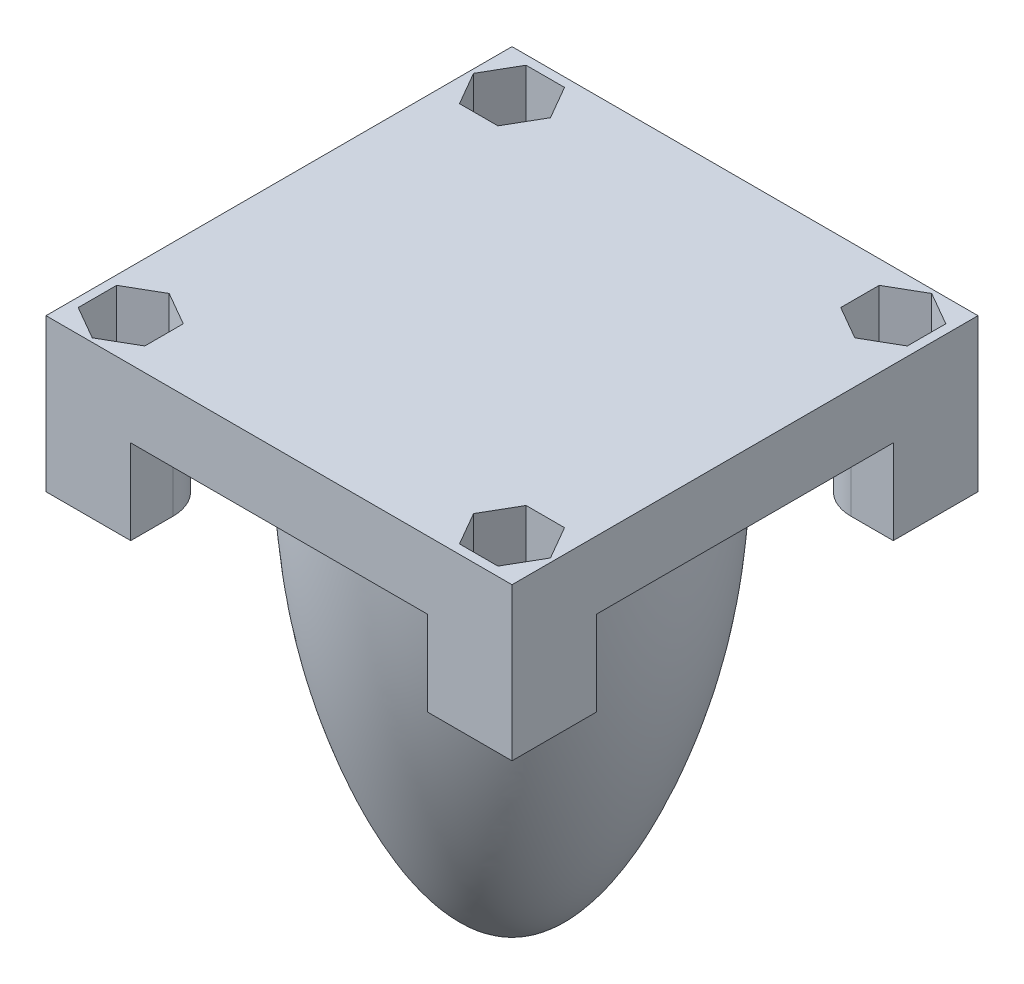
from build123d import *

# Parameters (mm, degrees)
SKETCH5_W           = 55
SKETCH5_H           = 70
BOSS_EXTRUDE8_DEPTH = 27.5
SKETCH6_W           = 10
SKETCH6_H           = 10
BOSS_EXTRUDE9_DEPTH = 10
SKETCH7_R           = 1.75
CUT_EXTRUDE2_DEPTH  = 59.723930461
CUT_EXTRUDE3_DEPTH  = 7
CIRPATTERN1_COUNT   = 4
FILLET1_R           = 5


with BuildPart() as part:
    # Sketch5 → Boss-Extrude8 (new, symmetric)
    with BuildSketch(Plane.XY):
        with Locations((0, 30)):
            Rectangle(SKETCH5_W, SKETCH5_H)
    extrude(amount=BOSS_EXTRUDE8_DEPTH, both=True)

    # Sketch1 → Cut-Revolve1 (revolve, cut)
    with BuildSketch(Plane(origin=(0, 0, 0), x_dir=(0, 0, -1), z_dir=(1, 0, 0))):
        with BuildLine():
            Line((0, -7), (0, 3))
            add(Edge.make_bspline(
                [(20, 55), (20, 43.957678864), (18.5157836, 25.942674232), (6.738040747, 3), (0, 3)],
                knots=[0, 0, 0, 0, 0.518417095, 1, 1, 1, 1], degree=3))
            Line((20, 55), (20, 57))
            ThreePointArc((20, 57), (20.585786438, 58.414213562), (22, 59))
            Line((22, 59), (23.4, 59))
            ThreePointArc((23.4, 59), (24.814213562, 58.414213562), (25.4, 57))
            Line((25.4, 57), (304.80691679, 57))
            Line((304.80691679, 57), (304.80691679, -311.267440696))
            Line((304.80691679, -311.267440696), (0, -311.267440696))
            Line((0, -311.267440696), (0, -7))
        make_face()
    revolve(axis=Axis((0, 0, 0), (0, 1, 0)), mode=Mode.SUBTRACT)

    # Sketch6 → Boss-Extrude9 (add)
    with BuildSketch(Plane.XZ.offset(-57)):
        with Locations((-22.5, 22.5)):
            Rectangle(SKETCH6_W, SKETCH6_H)
    boss_extrude9 = extrude(amount=BOSS_EXTRUDE9_DEPTH)

    # Sketch7 → Cut-Extrude2 (cut, through all)
    with BuildSketch(Plane.XZ.offset(-47)):
        with Locations(Location((-22.5, 22.5, 0), (0, 0, 270))):
            Circle(SKETCH7_R)
    cut_extrude2 = extrude(amount=-CUT_EXTRUDE2_DEPTH, mode=Mode.SUBTRACT)

    # Sketch8 → Cut-Extrude3 (cut)
    with BuildSketch(Plane(origin=(0, 65, 0), x_dir=(1, 0, 0), z_dir=(0, 1, 0))):
        Polygon((-22.5, -17.962026884), (-26.43, -20.231013442), (-26.43, -24.768986558), (-22.5, -27.037973116), (-18.57, -24.768986558), (-18.57, -20.231013442), align=None)
    cut_extrude3 = extrude(amount=-CUT_EXTRUDE3_DEPTH, mode=Mode.SUBTRACT)

    # CirPattern1: Boss-Extrude9, Cut-Extrude2, Cut-Extrude3 ×4 about axis
    cirpattern1_axis = Axis((0, 0, 0), (0, 1, 0))
    add([boss_extrude9.rotate(cirpattern1_axis, i * 360 / CIRPATTERN1_COUNT) for i in range(1, CIRPATTERN1_COUNT)])
    add([cut_extrude2.rotate(cirpattern1_axis, i * 360 / CIRPATTERN1_COUNT) for i in range(1, CIRPATTERN1_COUNT)], mode=Mode.SUBTRACT)
    add([cut_extrude3.rotate(cirpattern1_axis, i * 360 / CIRPATTERN1_COUNT) for i in range(1, CIRPATTERN1_COUNT)], mode=Mode.SUBTRACT)

    # Fillet1
    # the kernel refuses this fillet: 5 mm, written as the material it takes off along each edge
    with BuildSketch(Plane(origin=(-17.5, 57, 17.5), x_dir=(0, 0, 1), z_dir=(0, -1, 0)), Plane(origin=(17.5, 57, 17.5), x_dir=(1, 0, 0), z_dir=(0, -1, 0))) as fillet1_piece_1:
        with BuildLine():
            CenterArc((FILLET1_R, FILLET1_R), FILLET1_R, 180, 90)
            Line((0, FILLET1_R), (0, 0))
            Line((0, 0), (FILLET1_R, 0))
        make_face()
    extrude(amount=22.5, mode=Mode.SUBTRACT)
    with BuildSketch(Plane(origin=(-17.5, 57, -17.5), x_dir=(0, 0, -1), z_dir=(0, -1, 0)), Plane(origin=(17.5, 57, -17.5), x_dir=(1, 0, 0), z_dir=(0, -1, 0))) as fillet1_piece_2:
        with BuildLine():
            CenterArc((FILLET1_R, -FILLET1_R), FILLET1_R, 90, 90)
            Line((0, -FILLET1_R), (0, 0))
            Line((0, 0), (FILLET1_R, 0))
        make_face()
    extrude(amount=22.5, mode=Mode.SUBTRACT)


solid = part.part
